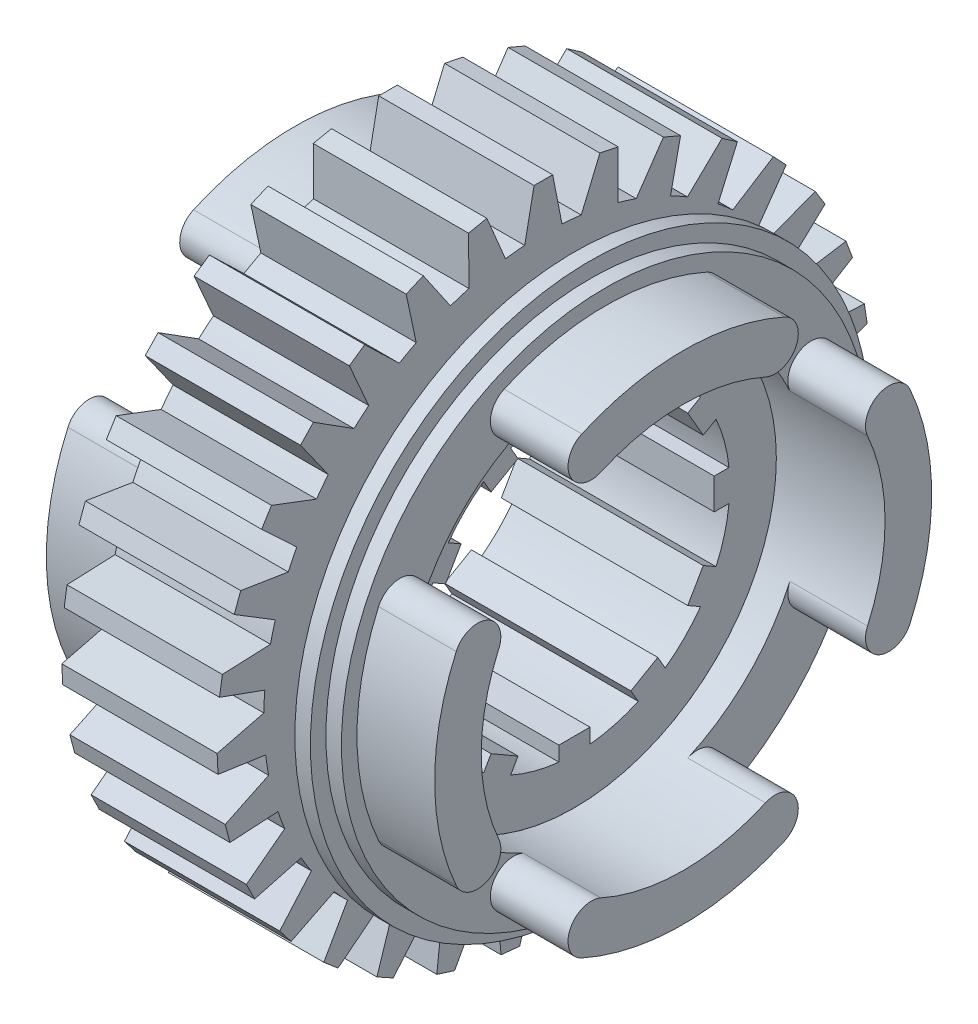
from build123d import *
from build123d.topology import SkipClean

# Parameters (mm, degrees)
SKETCH1_R            = 13
BOSS_EXTRUDE1_DEPTH  = 6
BOSS_EXTRUDE2_DEPTH  = 6
CIRPATTERN1_COUNT    = 12
BOSS_EXTRUDE3_DEPTH  = 5
BOSS_EXTRUDE4_DEPTH  = 5
CIRPATTERN2_COUNT    = 31
BOSS_EXTRUDE5_START  = 1
BOSS_EXTRUDE5_DEPTH  = 2
BOSS_EXTRUDE6_START  = 1
SKETCH3_4_R          = 18
SKETCH3_4_R_2        = 13
BOSS_EXTRUDE6_DEPTH  = 1
BOSS_EXTRUDE7_START  = 3
BOSS_EXTRUDE7_DEPTH  = 1
BOSS_EXTRUDE8_START  = 8
BOSS_EXTRUDE8_DEPTH  = 5
FILLET1_START        = 9
FILLET1_DEPTH        = 5
FILLET2_START        = 9
FILLET2_DEPTH        = 5
CIRPATTERN3_COUNT    = 4
BOSS_EXTRUDE11_START = 1
SKETCH4_R            = 12
BOSS_EXTRUDE11_DEPTH = 1
BOSS_EXTRUDE12_DEPTH = 1
BOSS_EXTRUDE13_START = 1
BOSS_EXTRUDE13_DEPTH = 5
FILLET3_START        = -11
FILLET3_DEPTH        = 5
FILLET4_START        = -11
FILLET4_DEPTH        = 5
CIRPATTERN4_COUNT    = 4
SKETCH8_R            = 12
SKETCH8_R_2          = 8.5
CUT_EXTRUDE1_DEPTH   = 1


with BuildPart() as part:
    # Sketch1 → Boss-Extrude1 (new, symmetric)
    # profile 1 of 3: a face of its own
    with SkipClean():  # the faces are left unmerged after this step: merging them gives an invalid solid
        with BuildSketch(Plane.YZ):
            with Locations(Location((0, 0, 0), (0, 0, 270))):
                Circle(SKETCH1_R)
            with BuildLine():
                Line((-1, 9.949874371), (-1, 10))
                Line((-1, 10), (0, 10))
                Line((0, 10), (1, 10))
                Line((1, 10), (1, 9.949874371))
                ThreePointArc((1, 9.949874371), (7.416198487, 6.708203932), (10, 0))
                ThreePointArc((10, 0), (-6.708203932, -7.416198487), (-1, 9.949874371))
            make_face(mode=Mode.SUBTRACT)
        # profile 2 of 3: a face of its own
        with BuildSketch(Plane.YZ):
            with BuildLine():
                Line((0, 10), (-1, 10))
                Line((-1, 10), (-1, 9.949874371))
                ThreePointArc((-1, 9.949874371), (-0.500627751, 9.987460731), (0, 10))
            make_face()
        # profile 3 of 3: a face of its own
        with BuildSketch(Plane.YZ):
            with BuildLine():
                Line((1, 10), (0, 10))
                ThreePointArc((0, 10), (0.500627751, 9.987460731), (1, 9.949874371))
                Line((1, 9.949874371), (1, 10))
            make_face()
        extrude(amount=BOSS_EXTRUDE1_DEPTH, both=True)
    add(part.part.scale(1), mode=Mode.REPLACE)  # the faces are merged on a copy

    # Sketch1<4> → Boss-Extrude2 (add, symmetric)
    with BuildSketch(Plane.YZ):
        with BuildLine():
            ThreePointArc((1, 9.949874371), (0.500627751, 9.987460731), (0, 10))
            ThreePointArc((0, 10), (-0.500627751, 9.987460731), (-1, 9.949874371))
            Line((-1, 9.949874371), (-1, 9))
            Line((-1, 9), (1, 9))
            Line((1, 9), (1, 9.949874371))
        make_face()
    boss_extrude2 = extrude(amount=BOSS_EXTRUDE2_DEPTH, both=True)

    # CirPattern1: Boss-Extrude2 ×12 about axis
    cirpattern1_axis = Axis((0, 0, 0), (1, 0, 0))
    for i in range(1, CIRPATTERN1_COUNT):
        add(boss_extrude2.rotate(cirpattern1_axis, i * 360 / CIRPATTERN1_COUNT))

    # Sketch2 → Boss-Extrude3 (add, symmetric)
    with BuildSketch(Plane.YZ):
        with BuildLine():
            ThreePointArc((18, 0), (17.989986079, 0.600333983), (17.959955457, 1.2))
            ThreePointArc((17.959955457, 1.2), (-0.600333983, 17.989986079), (-18, 0))
            Line((-18, 0), (-13, 0))
            ThreePointArc((-13, 0), (0, 13), (13, 0))
            Line((13, 0), (18, 0))
        make_face()
        with BuildLine():
            ThreePointArc((17.959955457, -1.2), (17.989986079, -0.600333983), (18, 0))
            Line((18, 0), (13, 0))
            ThreePointArc((13, 0), (0, -13), (-13, 0))
            Line((-13, 0), (-18, 0))
            ThreePointArc((-18, 0), (-0.600333983, -17.989986079), (17.959955457, -1.2))
        make_face()
    extrude(amount=BOSS_EXTRUDE3_DEPTH, both=True)

    # Sketch2<3> → Boss-Extrude4 (add, symmetric)
    with BuildSketch(Plane.YZ):
        with BuildLine():
            Line((21, 0), (21, 0.6))
            Line((21, 0.6), (17.959955457, 1.2))
            ThreePointArc((17.959955457, 1.2), (17.989986079, 0.600333983), (18, 0))
            Line((18, 0), (21, 0))
        make_face()
        with BuildLine():
            Line((21, -0.6), (21, 0))
            Line((21, 0), (18, 0))
            ThreePointArc((18, 0), (17.989986079, -0.600333983), (17.959955457, -1.2))
            Line((17.959955457, -1.2), (21, -0.6))
        make_face()
    boss_extrude4 = extrude(amount=BOSS_EXTRUDE4_DEPTH, both=True)

    # CirPattern2: Boss-Extrude4 ×31 about axis
    cirpattern2_axis = Axis((0, 0, 0), (1, 0, 0))
    for i in range(1, CIRPATTERN2_COUNT):
        add(boss_extrude4.rotate(cirpattern2_axis, i * 360 / CIRPATTERN2_COUNT))

    # Sketch3 → Boss-Extrude5 (add)
    with SkipClean():  # the faces are left unmerged after this step: merging them gives an invalid solid
        with BuildSketch(Plane.YZ.offset(6).offset(BOSS_EXTRUDE5_START)):
            with BuildLine():
                Line((-6.5, 11.258330249), (-6, 10.392304845))
                ThreePointArc((-6, 10.392304845), (-3.105828541, 11.591109915), (0, 12))
                Line((0, 12), (0, 13))
                ThreePointArc((0, 13), (-3.364647586, 12.557035742), (-6.5, 11.258330249))
            make_face()
            with BuildLine():
                Line((0, 13), (0, 12))
                ThreePointArc((0, 12), (3.105828541, 11.591109915), (6, 10.392304845))
                Line((6, 10.392304845), (6.5, 11.258330249))
                ThreePointArc((6.5, 11.258330249), (3.364647586, 12.557035742), (0, 13))
            make_face()
            with BuildLine():
                ThreePointArc((12, 0), (-6, -10.392304845), (-6, 10.392304845))
                Line((-6, 10.392304845), (-6.5, 11.258330249))
                ThreePointArc((-6.5, 11.258330249), (-6.5, -11.258330249), (13, 0))
                ThreePointArc((13, 0), (11.258330249, 6.5), (6.5, 11.258330249))
                Line((6.5, 11.258330249), (6, 10.392304845))
                ThreePointArc((6, 10.392304845), (10.392304845, 6), (12, 0))
            make_face()
        extrude(amount=-BOSS_EXTRUDE5_DEPTH)
    add(part.part.scale(1), mode=Mode.REPLACE)  # the faces are merged on a copy

    # Sketch4 → Boss-Extrude11 (add)
    with BuildSketch(Plane.YZ.offset(6).offset(BOSS_EXTRUDE11_START)):
        Circle(SKETCH4_R)
        with BuildLine():
            ThreePointArc((-9.949874371, 1), (-9.659258263, 2.588190451), (-9.11684397, 4.108911782))
            Line((-9.11684397, 4.108911782), (-8.294228634, 3.633974596))
            Line((-8.294228634, 3.633974596), (-7.294228634, 5.366025404))
            Line((-7.294228634, 5.366025404), (-8.11684397, 5.840962589))
            ThreePointArc((-8.11684397, 5.840962589), (-7.071067812, 7.071067812), (-5.840962589, 8.11684397))
            Line((-5.840962589, 8.11684397), (-5.366025404, 7.294228634))
            Line((-5.366025404, 7.294228634), (-3.633974596, 8.294228634))
            Line((-3.633974596, 8.294228634), (-4.108911782, 9.11684397))
            ThreePointArc((-4.108911782, 9.11684397), (-2.588190451, 9.659258263), (-1, 9.949874371))
            Line((-1, 9.949874371), (-1, 9))
            Line((-1, 9), (1, 9))
            Line((1, 9), (1, 9.949874371))
            ThreePointArc((1, 9.949874371), (2.588190451, 9.659258263), (4.108911782, 9.11684397))
            Line((4.108911782, 9.11684397), (3.633974596, 8.294228634))
            Line((3.633974596, 8.294228634), (5.366025404, 7.294228634))
            Line((5.366025404, 7.294228634), (5.840962589, 8.11684397))
            ThreePointArc((5.840962589, 8.11684397), (7.071067812, 7.071067812), (8.11684397, 5.840962589))
            Line((8.11684397, 5.840962589), (7.294228634, 5.366025404))
            Line((7.294228634, 5.366025404), (8.294228634, 3.633974596))
            Line((8.294228634, 3.633974596), (9.11684397, 4.108911782))
            ThreePointArc((9.11684397, 4.108911782), (9.659258263, 2.588190451), (9.949874371, 1))
            Line((9.949874371, 1), (9, 1))
            Line((9, 1), (9, -1))
            Line((9, -1), (9.949874371, -1))
            ThreePointArc((9.949874371, -1), (9.659258263, -2.588190451), (9.11684397, -4.108911782))
            Line((9.11684397, -4.108911782), (8.294228634, -3.633974596))
            Line((8.294228634, -3.633974596), (7.294228634, -5.366025404))
            Line((7.294228634, -5.366025404), (8.11684397, -5.840962589))
            ThreePointArc((8.11684397, -5.840962589), (7.071067812, -7.071067812), (5.840962589, -8.11684397))
            Line((5.840962589, -8.11684397), (5.366025404, -7.294228634))
            Line((5.366025404, -7.294228634), (3.633974596, -8.294228634))
            Line((3.633974596, -8.294228634), (4.108911782, -9.11684397))
            ThreePointArc((4.108911782, -9.11684397), (2.588190451, -9.659258263), (1, -9.949874371))
            Line((1, -9.949874371), (1, -9))
            Line((1, -9), (-1, -9))
            Line((-1, -9), (-1, -9.949874371))
            ThreePointArc((-1, -9.949874371), (-2.588190451, -9.659258263), (-4.108911782, -9.11684397))
            Line((-4.108911782, -9.11684397), (-3.633974596, -8.294228634))
            Line((-3.633974596, -8.294228634), (-5.366025404, -7.294228634))
            Line((-5.366025404, -7.294228634), (-5.840962589, -8.11684397))
            ThreePointArc((-5.840962589, -8.11684397), (-7.071067812, -7.071067812), (-8.11684397, -5.840962589))
            Line((-8.11684397, -5.840962589), (-7.294228634, -5.366025404))
            Line((-7.294228634, -5.366025404), (-8.294228634, -3.633974596))
            Line((-8.294228634, -3.633974596), (-9.11684397, -4.108911782))
            ThreePointArc((-9.11684397, -4.108911782), (-9.659258263, -2.588190451), (-9.949874371, -1))
            Line((-9.949874371, -1), (-9, -1))
            Line((-9, -1), (-9, 1))
            Line((-9, 1), (-9.949874371, 1))
        make_face(mode=Mode.SUBTRACT)
    extrude(amount=-BOSS_EXTRUDE11_DEPTH)

    # Sketch7 → Boss-Extrude12 (add)
    with BuildSketch(Plane(origin=(-5, 0, 0), x_dir=(0, -1, 0), z_dir=(-1, 0, 0))):
        with BuildLine():
            ThreePointArc((13, 0), (-6.5, -11.258330249), (-6.5, 11.258330249))
            Line((-6.5, 11.258330249), (-8, 13.856406461))
            ThreePointArc((-8, 13.856406461), (-8, -13.856406461), (16, 0))
            ThreePointArc((16, 0), (13.856406461, 8), (8, 13.856406461))
            Line((8, 13.856406461), (6.5, 11.258330249))
            ThreePointArc((6.5, 11.258330249), (11.258330249, 6.5), (13, 0))
        make_face()
        with BuildLine():
            Line((-8, 13.856406461), (-6.5, 11.258330249))
            ThreePointArc((-6.5, 11.258330249), (-3.364647586, 12.557035742), (0, 13))
            Line((0, 13), (0, 16))
            ThreePointArc((0, 16), (-4.141104722, 15.454813221), (-8, 13.856406461))
        make_face()
        with BuildLine():
            Line((0, 16), (0, 13))
            ThreePointArc((0, 13), (3.364647586, 12.557035742), (6.5, 11.258330249))
            Line((6.5, 11.258330249), (8, 13.856406461))
            ThreePointArc((8, 13.856406461), (4.141104722, 15.454813221), (0, 16))
        make_face()
    extrude(amount=BOSS_EXTRUDE12_DEPTH)

    # Sketch7<3> → Boss-Extrude13 (add)
    with BuildSketch(Plane(origin=(-5, 0, 0), x_dir=(0, -1, 0), z_dir=(-1, 0, 0)).offset(BOSS_EXTRUDE13_START)):
        with BuildLine():
            Line((-8, 13.856406461), (-6.5, 11.258330249))
            ThreePointArc((-6.5, 11.258330249), (-3.364647586, 12.557035742), (0, 13))
            Line((0, 13), (0, 16))
            ThreePointArc((0, 16), (-4.141104722, 15.454813221), (-8, 13.856406461))
        make_face()
        with BuildLine():
            Line((0, 16), (0, 13))
            ThreePointArc((0, 13), (3.364647586, 12.557035742), (6.5, 11.258330249))
            Line((6.5, 11.258330249), (8, 13.856406461))
            ThreePointArc((8, 13.856406461), (4.141104722, 15.454813221), (0, 16))
        make_face()
    boss_extrude13 = extrude(amount=BOSS_EXTRUDE13_DEPTH)

    # Fillet3: read off the stored shape, not the designer's step
    # Fillet3 outline → Fillet3 (cut)
    with BuildSketch(Plane.YZ.offset(FILLET3_START)):
        with BuildLine():
            add(Edge.make_bspline(
                [(7.21109616, 12.489984928), (7.532816512, 13.047209958), (7.525075624, 13.652735586), (7.259068539, 14.138054534), (6.888562851, 14.446709239), (6.523657319, 14.609650755)],
                knots=[0.474066231, 0.474066231, 0.474066231, 0.474066231, 0.474066231, 0.474066231, 1, 1, 1, 1, 1, 1], degree=5, weights=[0.501345121, 0.490433565, 0.534843275, 0.634574251, 0.789626493, 1]))
            Line((7.21109616, 12.489984928), (8, 13.856406461))
            ThreePointArc((8, 13.856406461), (7.271588528, 14.252157741), (6.523657319, 14.609650755))
        make_face()
        with BuildLine():
            add(Edge.make_bspline(
                [(5.300471572, 11.870341239), (5.62096925, 11.727229192), (6.029593224, 11.655684629), (6.496570932, 11.727638268), (6.932873602, 12.008098805), (7.21109616, 12.489984928)],
                knots=[0, 0, 0, 0, 0, 0, 0.474066231, 0.474066231, 0.474066231, 0.474066231, 0.474066231, 0.474066231], degree=5, weights=[1, 0.810373507, 0.665694773, 0.565963797, 0.51118058, 0.501345121]))
            ThreePointArc((5.300471572, 11.870341239), (5.908165679, 11.579878165), (6.5, 11.258330249))
            Line((6.5, 11.258330249), (7.21109616, 12.489984928))
        make_face()
    fillet3 = extrude(amount=FILLET3_DEPTH, mode=Mode.SUBTRACT)

    # Fillet4: read off the stored shape, not the designer's step
    # Fillet4 outline → Fillet4 (cut)
    with BuildSketch(Plane.YZ.offset(FILLET4_START)):
        with BuildLine():
            add(Edge.make_bspline(
                [(-7.211102568, 12.489996027), (-6.932882332, 12.008104416), (-6.496578376, 11.727639415), (-6.029597718, 11.655683842), (-5.620971036, 11.727228394), (-5.300471571, 11.870341239)],
                knots=[0.525931627, 0.525931627, 0.525931627, 0.525931627, 0.525931627, 0.525931627, 1, 1, 1, 1, 1, 1], degree=5, weights=[0.501344898, 0.51117959, 0.565962446, 0.665693466, 0.810372651, 1]))
            Line((-7.211102568, 12.489996027), (-6.5, 11.258330249))
            ThreePointArc((-6.5, 11.258330249), (-5.908165679, 11.579878165), (-5.300471571, 11.870341239))
        make_face()
        with BuildLine():
            add(Edge.make_bspline(
                [(-6.523657318, 14.609650755), (-6.888560968, 14.44671008), (-7.259064784, 14.138057662), (-7.525071768, 13.652742621), (-7.532816375, 13.047220715), (-7.211102568, 12.489996027)],
                knots=[0, 0, 0, 0, 0, 0, 0.525931627, 0.525931627, 0.525931627, 0.525931627, 0.525931627, 0.525931627], degree=5, weights=[1, 0.789627349, 0.634575514, 0.534844493, 0.490434288, 0.501344898]))
            ThreePointArc((-6.523657318, 14.609650755), (-7.271588527, 14.252157741), (-8, 13.856406461))
            Line((-8, 13.856406461), (-7.211102568, 12.489996027))
        make_face()
    fillet4 = extrude(amount=FILLET4_DEPTH, mode=Mode.SUBTRACT)

    # CirPattern4: Boss-Extrude13, Fillet3, Fillet4 ×4 about axis
    cirpattern4_axis = Axis((0, 0, 0), (1, 0, 0))
    add([boss_extrude13.rotate(cirpattern4_axis, i * 360 / CIRPATTERN4_COUNT) for i in range(1, CIRPATTERN4_COUNT)])
    add([fillet3.rotate(cirpattern4_axis, i * 360 / CIRPATTERN4_COUNT) for i in range(1, CIRPATTERN4_COUNT)], mode=Mode.SUBTRACT)
    add([fillet4.rotate(cirpattern4_axis, i * 360 / CIRPATTERN4_COUNT) for i in range(1, CIRPATTERN4_COUNT)], mode=Mode.SUBTRACT)

    # Sketch8 → Cut-Extrude1 (cut)
    with BuildSketch(Plane(origin=(-6, 0, 0), x_dir=(0, -1, 0), z_dir=(-1, 0, 0))):
        with Locations(Location((0, 0, 0), (0, 0, 90))):
            Circle(SKETCH8_R)
        Circle(SKETCH8_R_2, mode=Mode.SUBTRACT)
    extrude(amount=-CUT_EXTRUDE1_DEPTH, mode=Mode.SUBTRACT)


with BuildPart() as body_2:
    # Sketch3<4> → Boss-Extrude6 (new body)
    with BuildSketch(Plane.YZ.offset(6).offset(BOSS_EXTRUDE6_START)):
        with Locations(Location((0, 0, 0), (0, 0, 270))):
            Circle(SKETCH3_4_R)
        with Locations(Location((0, 0, 0), (0, 0, 270))):
            Circle(SKETCH3_4_R_2, mode=Mode.SUBTRACT)
    extrude(amount=BOSS_EXTRUDE6_DEPTH)

    # Sketch3<8> → Boss-Extrude7 (add)
    with SkipClean():  # the faces are left unmerged after this step: merging them gives an invalid solid
        with BuildSketch(Plane.YZ.offset(6).offset(BOSS_EXTRUDE7_START)):
            with BuildLine():
                Line((-8.5, 14.722431864), (-8, 13.856406461))
                ThreePointArc((-8, 13.856406461), (-4.141104722, 15.454813221), (0, 16))
                Line((0, 16), (0, 17))
                ThreePointArc((0, 17), (-4.399923767, 16.420739047), (-8.5, 14.722431864))
            make_face()
            with BuildLine():
                Line((0, 17), (0, 16))
                ThreePointArc((0, 16), (4.141104722, 15.454813221), (8, 13.856406461))
                Line((8, 13.856406461), (8.5, 14.722431864))
                ThreePointArc((8.5, 14.722431864), (4.399923767, 16.420739047), (0, 17))
            make_face()
            with BuildLine():
                ThreePointArc((16, 0), (-8, -13.856406461), (-8, 13.856406461))
                Line((-8, 13.856406461), (-8.5, 14.722431864))
                ThreePointArc((-8.5, 14.722431864), (-8.5, -14.722431864), (17, 0))
                ThreePointArc((17, 0), (14.722431864, 8.5), (8.5, 14.722431864))
                Line((8.5, 14.722431864), (8, 13.856406461))
                ThreePointArc((8, 13.856406461), (13.856406461, 8), (16, 0))
            make_face()
            with BuildLine():
                Line((-8, 13.856406461), (-6.5, 11.258330249))
                ThreePointArc((-6.5, 11.258330249), (-3.364647586, 12.557035742), (0, 13))
                Line((0, 13), (0, 16))
                ThreePointArc((0, 16), (-4.141104722, 15.454813221), (-8, 13.856406461))
            make_face()
            with BuildLine():
                ThreePointArc((13, 0), (-6.5, -11.258330249), (-6.5, 11.258330249))
                Line((-6.5, 11.258330249), (-8, 13.856406461))
                ThreePointArc((-8, 13.856406461), (-8, -13.856406461), (16, 0))
                ThreePointArc((16, 0), (13.856406461, 8), (8, 13.856406461))
                Line((8, 13.856406461), (6.5, 11.258330249))
                ThreePointArc((6.5, 11.258330249), (11.258330249, 6.5), (13, 0))
            make_face()
            with BuildLine():
                Line((0, 16), (0, 13))
                ThreePointArc((0, 13), (3.364647586, 12.557035742), (6.5, 11.258330249))
                Line((6.5, 11.258330249), (8, 13.856406461))
                ThreePointArc((8, 13.856406461), (4.141104722, 15.454813221), (0, 16))
            make_face()
        extrude(amount=-BOSS_EXTRUDE7_DEPTH)

    # Sketch3<9> → Boss-Extrude8 (add)
    with SkipClean():  # the faces are left unmerged after this step: merging them gives an invalid solid
        with BuildSketch(Plane.YZ.offset(6).offset(BOSS_EXTRUDE8_START)):
            with BuildLine():
                Line((-8, 13.856406461), (-6.5, 11.258330249))
                ThreePointArc((-6.5, 11.258330249), (-3.364647586, 12.557035742), (0, 13))
                Line((0, 13), (0, 16))
                ThreePointArc((0, 16), (-4.141104722, 15.454813221), (-8, 13.856406461))
            make_face()
            with BuildLine():
                Line((0, 16), (0, 13))
                ThreePointArc((0, 13), (3.364647586, 12.557035742), (6.5, 11.258330249))
                Line((6.5, 11.258330249), (8, 13.856406461))
                ThreePointArc((8, 13.856406461), (4.141104722, 15.454813221), (0, 16))
            make_face()
        boss_extrude8 = extrude(amount=-BOSS_EXTRUDE8_DEPTH)

    # Fillet1: read off the stored shape, not the designer's step
    # Fillet1 outline → Fillet1 (cut)
    with SkipClean():  # the faces are left unmerged after this step: merging them gives an invalid solid
        with BuildSketch(Plane.YZ.offset(FILLET1_START)):
            with BuildLine():
                ThreePointArc((-6.5, 11.258330249), (-5.908165679, 11.579878165), (-5.300471571, 11.870341239))
                add(Edge.make_bspline(
                    [(-5.300471571, 11.870341239), (-5.620971029, 11.727228397), (-6.0295977, 11.655683845), (-6.496578345, 11.72763941), (-6.932882295, 12.008104393), (-7.211102541, 12.48999598)],
                    knots=[0, 0, 0, 0, 0, 0, 0.474068364, 0.474068364, 0.474068364, 0.474068364, 0.474068364, 0.474068364], degree=5, weights=[1, 0.810372654, 0.665693471, 0.565962451, 0.511179594, 0.501344899]))
                Line((-7.211102541, 12.48999598), (-6.5, 11.258330249))
            make_face()
            with BuildLine():
                Line((-8, 13.856406461), (-7.211102541, 12.48999598))
                add(Edge.make_bspline(
                    [(-7.211102541, 12.48999598), (-7.532816375, 13.04722067), (-7.525071784, 13.652742591), (-7.2590648, 14.138057649), (-6.888560977, 14.446710076), (-6.523657318, 14.609650755)],
                    knots=[0.474068364, 0.474068364, 0.474068364, 0.474068364, 0.474068364, 0.474068364, 1, 1, 1, 1, 1, 1], degree=5, weights=[0.501344899, 0.490434285, 0.534844488, 0.634575508, 0.789627346, 1]))
                ThreePointArc((-6.523657318, 14.609650755), (-7.271588528, 14.252157742), (-8, 13.856406461))
            make_face()
        fillet1 = extrude(amount=FILLET1_DEPTH, mode=Mode.SUBTRACT)

    # Fillet2: read off the stored shape, not the designer's step
    # Fillet2 outline → Fillet2 (cut)
    with SkipClean():  # the faces are left unmerged after this step: merging them gives an invalid solid
        with BuildSketch(Plane.YZ.offset(FILLET2_START)):
            with BuildLine():
                ThreePointArc((8, 13.856406461), (7.271588528, 14.252157742), (6.523657319, 14.609650755))
                add(Edge.make_bspline(
                    [(6.523657319, 14.609650755), (6.88856286, 14.446709235), (7.259068556, 14.13805452), (7.525075641, 13.652735555), (7.532816513, 13.04720991), (7.211096132, 12.489984878)],
                    knots=[0, 0, 0, 0, 0, 0, 0.525933778, 0.525933778, 0.525933778, 0.525933778, 0.525933778, 0.525933778], degree=5, weights=[1, 0.789626489, 0.634574245, 0.53484327, 0.490433562, 0.501345122]))
                Line((7.211096132, 12.489984878), (8, 13.856406461))
            make_face()
            with BuildLine():
                Line((6.5, 11.258330249), (7.211096132, 12.489984878))
                add(Edge.make_bspline(
                    [(7.211096132, 12.489984878), (6.932873564, 12.00809878), (6.496570899, 11.727638263), (6.029593204, 11.655684632), (5.620969242, 11.727229195), (5.300471572, 11.870341239)],
                    knots=[0.525933778, 0.525933778, 0.525933778, 0.525933778, 0.525933778, 0.525933778, 1, 1, 1, 1, 1, 1], degree=5, weights=[0.501345122, 0.511180584, 0.565963803, 0.665694779, 0.810373511, 1]))
                ThreePointArc((5.300471572, 11.870341239), (5.908165679, 11.579878165), (6.5, 11.258330249))
            make_face()
        fillet2 = extrude(amount=FILLET2_DEPTH, mode=Mode.SUBTRACT)

    # CirPattern3: Boss-Extrude8, Fillet1, Fillet2 ×4 about axis
    with SkipClean():  # the faces are left unmerged after this step: merging them gives an invalid solid
        cirpattern3_axis = Axis((0, 0, 0), (1, 0, 0))
        add([boss_extrude8.rotate(cirpattern3_axis, i * 360 / CIRPATTERN3_COUNT) for i in range(1, CIRPATTERN3_COUNT)])
        add([fillet1.rotate(cirpattern3_axis, i * 360 / CIRPATTERN3_COUNT) for i in range(1, CIRPATTERN3_COUNT)], mode=Mode.SUBTRACT)
        add([fillet2.rotate(cirpattern3_axis, i * 360 / CIRPATTERN3_COUNT) for i in range(1, CIRPATTERN3_COUNT)], mode=Mode.SUBTRACT)


solid = Compound([part.part, body_2.part])
